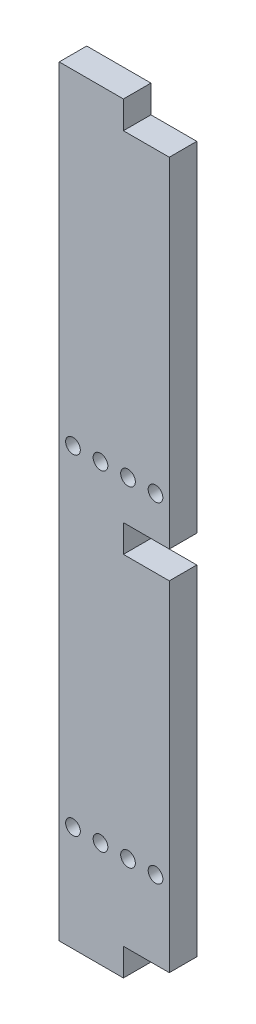
from build123d import *

# Parameters (mm, degrees)
ESQUISSE1_R             = 0.8
BOSS_EXTRU_1_DEPTH      = 3
ESQUISSE2_W             = 12
ESQUISSE2_H             = 17.5
ENL_V_MAT_EXTRU_1_DEPTH = 119.190524155


with BuildPart() as part:
    # Esquisse1 → Boss.-Extru.1 (new body)
    with BuildSketch(Plane.XY):
        Polygon((-6, 0), (6, 0), (6, 17.5), (1, 17.5), (1, 20.5), (6, 20.5), (6, 57.5), (1, 57.5), (1, 60.5), (6, 60.5), (6, 97.5), (1, 97.5), (1, 100.5), (6, 100.5), (6, 118), (-6, 118), align=None)
        with Locations((-4.5, 65)):
            Circle(ESQUISSE1_R, mode=Mode.SUBTRACT)
        with Locations((-1.5, 65)):
            Circle(ESQUISSE1_R, mode=Mode.SUBTRACT)
        with Locations((1.5, 65)):
            Circle(ESQUISSE1_R, mode=Mode.SUBTRACT)
        with Locations((4.5, 65)):
            Circle(ESQUISSE1_R, mode=Mode.SUBTRACT)
        with Locations((-4.5, 29)):
            Circle(ESQUISSE1_R, mode=Mode.SUBTRACT)
        with Locations((-1.5, 29)):
            Circle(ESQUISSE1_R, mode=Mode.SUBTRACT)
        with Locations((1.5, 29)):
            Circle(ESQUISSE1_R, mode=Mode.SUBTRACT)
        with Locations((4.5, 29)):
            Circle(ESQUISSE1_R, mode=Mode.SUBTRACT)
    extrude(amount=BOSS_EXTRU_1_DEPTH)

    # Esquisse2 → Enlèv. mat.-Extru.1 (cut, through all)
    with BuildSketch(Plane.XY.offset(3)):
        with Locations((0, 109.25)):
            Rectangle(ESQUISSE2_W, ESQUISSE2_H)
        with Locations((0, 8.75)):
            Rectangle(ESQUISSE2_W, ESQUISSE2_H)
    extrude(amount=-ENL_V_MAT_EXTRU_1_DEPTH, mode=Mode.SUBTRACT)


solid = part.part
